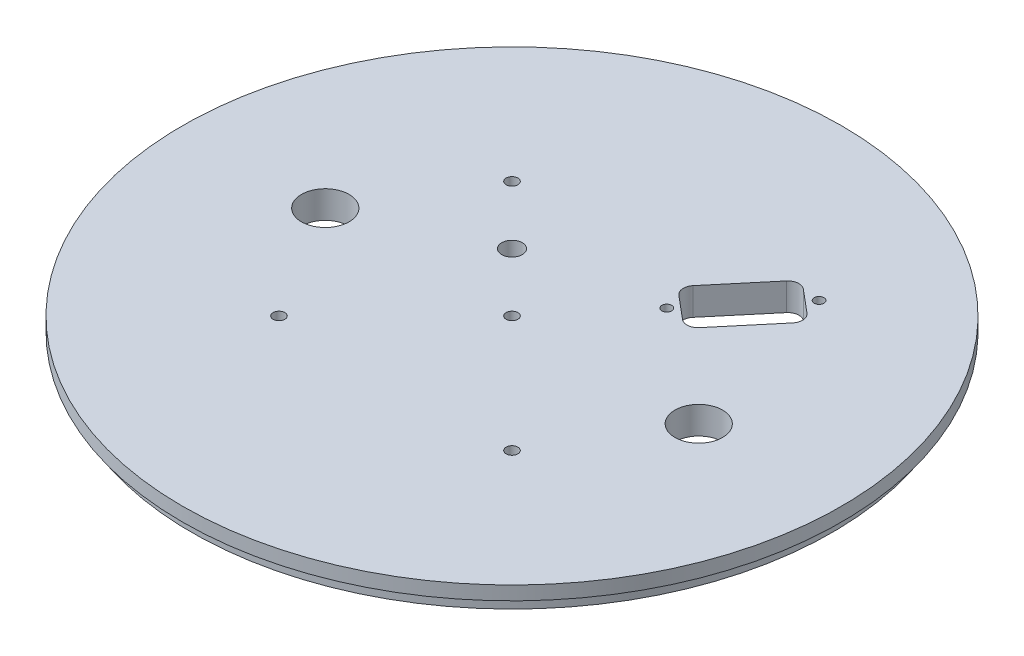
from build123d import *

# Parameters (mm, degrees)
SKETCH1_R                 = 76.2
SKETCH1_R_2               = 5.500000049
SKETCH1_R_3               = 1.3589
SKETCH1_R_4               = 2.38125
BOSS_EXTRUDE1_DEPTH       = 6.35
SKETCH2_R                 = 76.2
SKETCH2_R_2               = 74.041
CUT_EXTRUDE1_DEPTH        = 3.175
CUT_EXTRUDE2_START        = -3.175
CUT_EXTRUDE2_DEPTH        = 3.556
TAP_DRILL_FOR_4_40_TAP1_D = 2.2606
CUT_EXTRUDE3_DEPTH        = 108.95


with BuildPart() as part:
    # Sketch1 → Boss-Extrude1 (new body)
    with BuildSketch(Plane(origin=(0, 0, 0), x_dir=(1, 0, 0), z_dir=(0, 1, 0))):
        Circle(SKETCH1_R)
        with Locations((43.18, 0)):
            Circle(SKETCH1_R_2, mode=Mode.SUBTRACT)
        with Locations((-43.18, 0)):
            Circle(SKETCH1_R_2, mode=Mode.SUBTRACT)
        with Locations((-26.940768363, 26.940768363)):
            Circle(SKETCH1_R_3, mode=Mode.SUBTRACT)
        with Locations((26.940768363, -26.940768363)):
            Circle(SKETCH1_R_3, mode=Mode.SUBTRACT)
        with Locations((-13.470384182, 13.470384182)):
            Circle(SKETCH1_R_4, mode=Mode.SUBTRACT)
        with Locations((-26.940768363, -26.940768363)):
            Circle(SKETCH1_R_3, mode=Mode.SUBTRACT)
        Circle(SKETCH1_R_3, mode=Mode.SUBTRACT)
    extrude(amount=BOSS_EXTRUDE1_DEPTH)

    # Sketch2 → Cut-Extrude1 (cut)
    with BuildSketch(Plane.XZ):
        Circle(SKETCH2_R)
        Circle(SKETCH2_R_2, mode=Mode.SUBTRACT)
    extrude(amount=-CUT_EXTRUDE1_DEPTH, mode=Mode.SUBTRACT)

    # Sketch3 → Cut-Extrude2 (cut)
    with BuildSketch(Plane(origin=(0, 6.35, 0), x_dir=(1, 0, 0), z_dir=(0, 1, 0)).offset(CUT_EXTRUDE2_START)):
        with BuildLine():
            Line((3.2385, 34.798), (3.2385, 13.97))
            ThreePointArc((3.2385, 13.97), (0, 10.7315), (-3.2385, 13.97))
            Line((-3.2385, 13.97), (-3.2385, 34.798))
            ThreePointArc((-3.2385, 34.798), (0, 38.0365), (3.2385, 34.798))
        make_face()
        with BuildLine():
            Line((3.2385, -34.798), (3.2385, -13.97))
            ThreePointArc((3.2385, -13.97), (0, -10.7315), (-3.2385, -13.97))
            Line((-3.2385, -13.97), (-3.2385, -34.798))
            ThreePointArc((-3.2385, -34.798), (0, -38.0365), (3.2385, -34.798))
        make_face()
    extrude(amount=-CUT_EXTRUDE2_DEPTH, mode=Mode.SUBTRACT)

    # Tap Drill for #4-40 Tap1 (through all)
    with Locations(Plane(origin=(0, 6.35, 0), x_dir=(1, 0, 0), z_dir=(0, 1, 0))):
        with Locations((16.326805286, 19.457528855), (32.396495553, 38.608639962)):
            Hole(TAP_DRILL_FOR_4_40_TAP1_D / 2)

    # Sketch4 → Cut-Extrude3 (cut, through all)
    with BuildSketch(Plane(origin=(0, 6.35, 0), x_dir=(1, 0, 0), z_dir=(0, 1, 0))):
        with BuildLine():
            Line((15.169451366, 23.412825166), (20.422984157, 19.004587739))
            ThreePointArc((20.422984157, 19.004587739), (22.277040272, 18.420006091), (24.001417571, 19.317660095))
            Line((24.001417571, 19.317660095), (33.866921829, 31.074910238))
            ThreePointArc((33.866921829, 31.074910238), (34.451503477, 32.928966353), (33.553849472, 34.653343652))
            Line((33.553849472, 34.653343652), (28.300316681, 39.061581079))
            ThreePointArc((28.300316681, 39.061581079), (26.446260566, 39.646162727), (24.721883267, 38.748508722))
            Line((24.721883267, 38.748508722), (14.856379009, 26.99125858))
            ThreePointArc((14.856379009, 26.99125858), (14.271797362, 25.137202465), (15.169451366, 23.412825166))
        make_face()
    extrude(amount=-CUT_EXTRUDE3_DEPTH, mode=Mode.SUBTRACT)


solid = part.part
